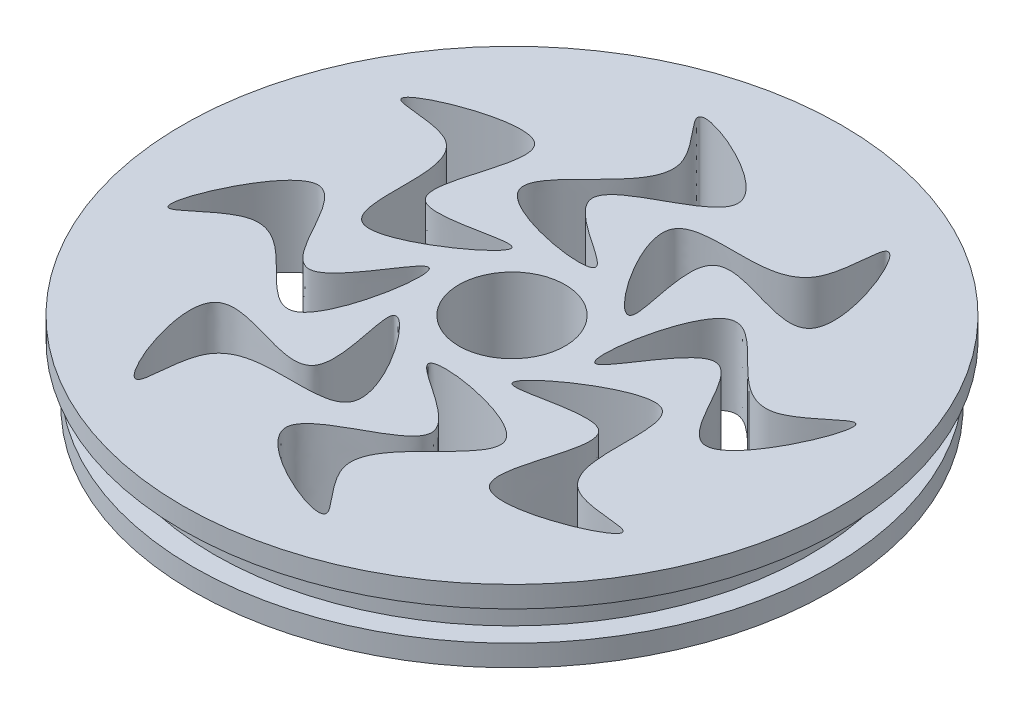
from build123d import *

# Parameters (mm, degrees)
SKETCH1_R           = 28
BOSS_EXTRUDE1_DEPTH = 7.5
SKETCH1_4_R         = 30
SKETCH1_4_R_2       = 28
BOSS_EXTRUDE3_DEPTH = 2
SKETCH4_R           = 31
BOSS_EXTRUDE4_DEPTH = 2
SKETCH6_R           = 5
CUT_EXTRUDE1_DEPTH  = 45.477522413
CUT_EXTRUDE3_DEPTH  = 45.477522413
CIRPATTERN2_COUNT   = 8


with BuildPart() as part:
    # Sketch1 → Boss-Extrude1 (new body)
    with BuildSketch(Plane(origin=(0, 0, 0), x_dir=(1, 0, 0), z_dir=(0, 1, 0))):
        Circle(SKETCH1_R)
    extrude(amount=BOSS_EXTRUDE1_DEPTH)

    # Sketch1<4> → Boss-Extrude3 (add)
    with BuildSketch(Plane(origin=(0, 0, 0), x_dir=(1, 0, 0), z_dir=(0, 1, 0))):
        Circle(SKETCH1_4_R)
        Circle(SKETCH1_4_R_2, mode=Mode.SUBTRACT)
    extrude(amount=BOSS_EXTRUDE3_DEPTH)

    # Sketch4 → Boss-Extrude4 (add)
    with BuildSketch(Plane(origin=(0, 7.5, 0), x_dir=(1, 0, 0), z_dir=(0, 1, 0))):
        Circle(SKETCH4_R)
    extrude(amount=-BOSS_EXTRUDE4_DEPTH)

    # Sketch6 → Cut-Extrude1 (cut, through all)
    with BuildSketch(Plane(origin=(0, 7.5, 0), x_dir=(1, 0, 0), z_dir=(0, 1, 0))):
        Circle(SKETCH6_R)
    extrude(amount=-CUT_EXTRUDE1_DEPTH, mode=Mode.SUBTRACT)

    # Sketch8 → Cut-Extrude3 (cut, through all)
    with BuildSketch(Plane(origin=(0, 7.5, 0), x_dir=(1, 0, 0), z_dir=(0, 1, 0))):
        with BuildLine():
            add(Edge.make_bspline(
                [(7.894717211, 0), (8.794267127, 0.113238493), (14.299488775, 12.259169912), (18.989139465, -9.725602617), (28.071174499, 11.983188193), (20.757621184, 3.345434996), (15.519043828, 5.73589758), (9.238301751, 15.274574463), (6.720604859, -0.147801374), (7.894717211, 0)],
                knots=[0, 0, 0, 0, 0.14232604, 0.322171931, 0.508640424, 0.607564135, 0.674447797, 0.814232919, 1, 1, 1, 1], degree=3))
        make_face()
    cut_extrude3 = extrude(amount=-CUT_EXTRUDE3_DEPTH, mode=Mode.SUBTRACT)

    # CirPattern2: Cut-Extrude3 ×8 about axis
    cirpattern2_axis = Axis((0, 0, 0), (0, 1, 0))
    for i in range(1, CIRPATTERN2_COUNT):
        add(cut_extrude3.rotate(cirpattern2_axis, i * 360 / CIRPATTERN2_COUNT), mode=Mode.SUBTRACT)


solid = part.part
